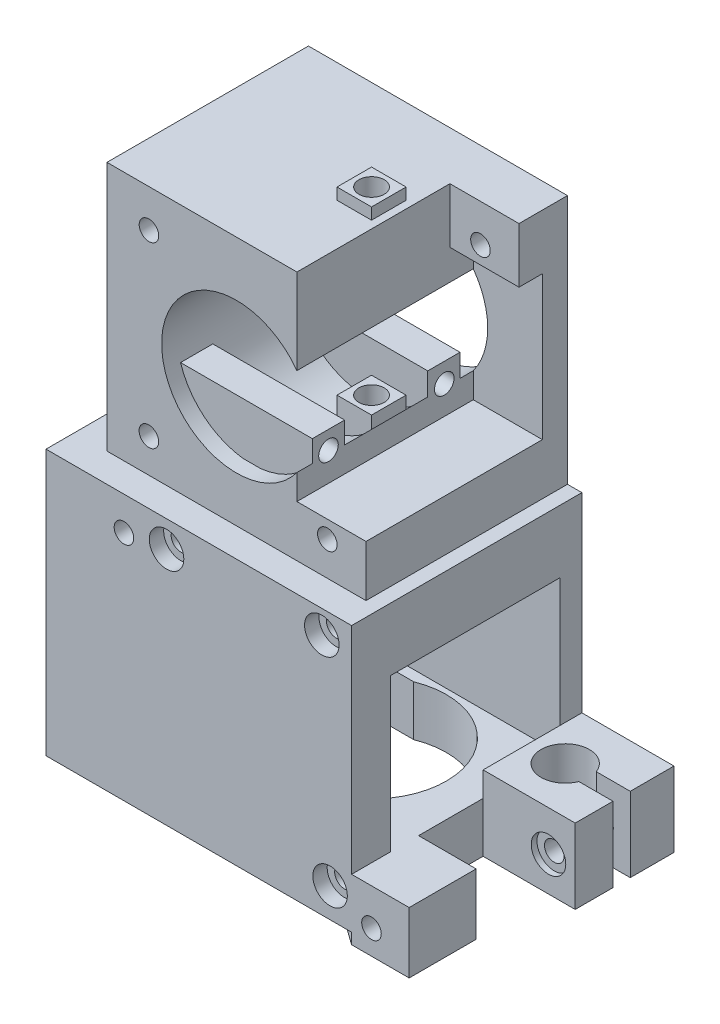
from build123d import *
from OCP.BRepAlgoAPI import BRepAlgoAPI_Cut
from OCP.TopTools import TopTools_ListOfShape

# Parameters (mm, degrees)
SKETCH1_W                     = 45
SKETCH1_H                     = 45
BOSS_EXTRUDE1_DEPTH           = 35
SKETCH2_R                     = 13
CUT_EXTRUDE3_DEPTH            = 35
SKETCH4_R                     = 1.7
CUT_EXTRUDE8_DEPTH            = 35
SKETCH7_R                     = 1.7
CUT_EXTRUDE9_DEPTH            = 35
SKETCH6_R                     = 1.7
CUT_EXTRUDE10_DEPTH           = 35
SKETCH5_R                     = 1.7
CUT_EXTRUDE11_DEPTH           = 35
CUT_EXTRUDE12_DEPTH           = 12
BOSS_EXTRUDE4_START           = -35.102303
SKETCH14_W                    = 6
SKETCH14_H                    = 6
BOSS_EXTRUDE4_DEPTH           = 37.102303
CUT_EXTRUDE17_START           = -7
SKETCH20_R                    = 2.2
CUT_EXTRUDE17_DEPTH           = 70.77141069
SKETCH21_R                    = 1.75
CUT_EXTRUDE18_DEPTH           = 2
BOSS_EXTRUDE5_DEPTH           = 44.571207257
BOSS_EXTRUDE5_DEPTH_BACK      = 1.562633388
SKETCH22_W                    = 53.082637552
SKETCH22_H                    = 40.002520942
SKETCH23_W                    = 29.449729346
SKETCH23_H                    = 26.517519529
CUT_EXTRUDE19_DEPTH           = 95.427299018
SKETCH25_R                    = 5
CUT_EXTRUDE24_DEPTH           = 2.6
SKETCH26_R                    = 8.5
CUT_EXTRUDE25_DEPTH           = 4
SKETCH27_R                    = 6.7
CUT_EXTRUDE28_DEPTH           = 6
SKETCH30_R                    = 13
CUT_EXTRUDE30_DEPTH           = 10.767560088
SKETCH31_W                    = 19.349450051
SKETCH31_H                    = 23.644133728
CUT_EXTRUDE31_DEPTH           = 9.664293754
SKETCH34_R                    = 1.5
CUT_EXTRUDE32_DEPTH           = 9
SKETCH37_W                    = 11.635024897
SKETCH37_H                    = 10.599921236
BOSS_EXTRUDE6_DEPTH           = 10
BOSS_EXTRUDE6_OTHER_WAY_DEPTH = 5
BOSS_EXTRUDE6_OTHER_WAY_TAPER = 29
SKETCH38_R                    = 1.7
CUT_EXTRUDE33_DEPTH           = 10
SKETCH39_R                    = 1.7
CUT_EXTRUDE34_DEPTH           = 88.0662855
SKETCH40_W                    = 17.159872711
SKETCH40_H                    = 13
BOSS_EXTRUDE7_DEPTH           = 16
SKETCH41_R                    = 4.2
CUT_EXTRUDE35_DEPTH           = 15
SKETCH42_W                    = 9.331425876
SKETCH42_H                    = 3
CUT_EXTRUDE36_DEPTH           = 15
CUT_EXTRUDE37_DEPTH           = 5
SKETCH44_R                    = 1.7
CUT_EXTRUDE38_DEPTH           = 23
CUT_EXTRUDE39_DEPTH           = 5
CUT_EXTRUDE40_DEPTH           = 5
CUT_EXTRUDE41_DEPTH           = 5
SKETCH53_R                    = 1.7
CUT_EXTRUDE42_DEPTH           = 90.646740997
SKETCH52_R                    = 1.7
CUT_EXTRUDE43_DEPTH           = 90.646740997
SKETCH51_R                    = 1.7
CUT_EXTRUDE44_DEPTH           = 90.646740997
CUT_EXTRUDE46_DEPTH           = 5
SKETCH57_R                    = 3
CUT_EXTRUDE48_DEPTH           = 2.5
SKETCH58_R                    = 3
CUT_EXTRUDE49_DEPTH           = 2.5
SKETCH59_R                    = 3
CUT_EXTRUDE50_DEPTH           = 2.5
SKETCH60_R                    = 3
CUT_EXTRUDE51_DEPTH           = 1
SKETCH61_W                    = 6.542017971
SKETCH61_H                    = 14.030300317
CUT_EXTRUDE52_DEPTH           = 6.5
SKETCH67_W                    = 5.604230097
SKETCH67_H                    = 8.996545788
BOSS_EXTRUDE8_DEPTH           = 33
SKETCH68_W                    = 5.604230097
SKETCH68_H                    = 9.400155495
BOSS_EXTRUDE9_DEPTH           = 33
SKETCH63_R                    = 1.7
CUT_EXTRUDE55_DEPTH           = 102.92049818
SKETCH62_R                    = 1.7
CUT_EXTRUDE56_DEPTH           = 102.92049818
SKETCH69_R                    = 3
CUT_EXTRUDE57_DEPTH           = 2.5
CUT_EXTRUDE58_DEPTH           = 2.5
SKETCH71_R                    = 3
CUT_EXTRUDE59_DEPTH           = 1


with BuildPart() as part:
    # Sketch1 → Boss-Extrude1 (new body)
    with BuildSketch(Plane.XY):
        Rectangle(SKETCH1_W, SKETCH1_H)
    extrude(amount=BOSS_EXTRUDE1_DEPTH)

    # Sketch2 → Cut-Extrude3 (cut)
    with BuildSketch(Plane.XY.offset(35)):
        Circle(SKETCH2_R)
    extrude(amount=-CUT_EXTRUDE3_DEPTH, mode=Mode.SUBTRACT)

    # Sketch4 → Cut-Extrude8 (cut)
    with BuildSketch(Plane(origin=(0, 0, 0), x_dir=(-1, 0, 0), z_dir=(0, 0, -1))):
        with Locations((-15.808862622, 15.928817575)):
            Circle(SKETCH4_R)
    extrude(amount=-CUT_EXTRUDE8_DEPTH, mode=Mode.SUBTRACT)

    # Sketch7 → Cut-Extrude9 (cut)
    with BuildSketch(Plane(origin=(0, 0, 0), x_dir=(-1, 0, 0), z_dir=(0, 0, -1))):
        with Locations((15.199970606, 15.923392722)):
            Circle(SKETCH7_R)
    extrude(amount=-CUT_EXTRUDE9_DEPTH, mode=Mode.SUBTRACT)

    # Sketch6 → Cut-Extrude10 (cut)
    with BuildSketch(Plane(origin=(0, 0, 0), x_dir=(-1, 0, 0), z_dir=(0, 0, -1))):
        with Locations((15.22029943, -15.065721832)):
            Circle(SKETCH6_R)
    extrude(amount=-CUT_EXTRUDE10_DEPTH, mode=Mode.SUBTRACT)

    # Sketch5 → Cut-Extrude11 (cut)
    with BuildSketch(Plane(origin=(0, 0, 0), x_dir=(-1, 0, 0), z_dir=(0, 0, -1))):
        with Locations((-15.781319068, -15.06525873)):
            Circle(SKETCH5_R)
    extrude(amount=-CUT_EXTRUDE11_DEPTH, mode=Mode.SUBTRACT)

    # Sketch8 → Cut-Extrude12 (cut)
    with BuildSketch(Plane(origin=(22.5, 0, 0), x_dir=(0, 0, -1), z_dir=(1, 0, 0))):
        Polygon((-4.363915061, -12.036124724), (-35, -12.036124724), (-35, 22.5), (-8.423058519, 22.5), (-8.423058519, 12.925541512), (-4.363915061, 12.925541512), align=None)
    extrude(amount=-CUT_EXTRUDE12_DEPTH, mode=Mode.SUBTRACT)

    # Sketch14 → Boss-Extrude4 (add)
    with BuildSketch(Plane(origin=(0, 22.5, 0), x_dir=(1, 0, 0), z_dir=(0, 1, 0)).offset(BOSS_EXTRUDE4_START)):
        with Locations((6.190916669, -17.729312446)):
            Rectangle(SKETCH14_W, SKETCH14_H)
    extrude(amount=BOSS_EXTRUDE4_DEPTH)

    # Sketch20 → Cut-Extrude17 (cut)
    with BuildSketch(Plane(origin=(0, 24.5, 0), x_dir=(1, 0, 0), z_dir=(0, 1, 0)).offset(CUT_EXTRUDE17_START)):
        with Locations(Location((6.190916669, -17.729312446, 0), (0, 0, 90))):
            Circle(SKETCH20_R)
    cut_extrude17 = extrude(amount=CUT_EXTRUDE17_DEPTH, mode=Mode.SUBTRACT)

    # Sketch21 → Cut-Extrude18 (cut)
    with BuildSketch(Plane(origin=(0, 17.5, 0), x_dir=(1, 0, 0), z_dir=(0, 1, 0))):
        with Locations(Location((6.190916669, -17.729312446, 0), (0, 0, 270))):
            Circle(SKETCH21_R)
    extrude(amount=-CUT_EXTRUDE18_DEPTH, mode=Mode.SUBTRACT)

    # Mirror6: Cut-Extrude17 across plane
    add(cut_extrude17.mirror(Plane.ZX.offset(16.5)), mode=Mode.SUBTRACT)

    # Sketch22 → Boss-Extrude5 (add, two sides: drawn at the far end of the back side and taken through both)
    with BuildSketch(Plane.XZ.offset(22.5).offset(-BOSS_EXTRUDE5_DEPTH_BACK)):
        with Locations((-1.541318776, 20.001258793)):
            Rectangle(SKETCH22_W, SKETCH22_H)
    extrude(amount=BOSS_EXTRUDE5_DEPTH + BOSS_EXTRUDE5_DEPTH_BACK)

    # Sketch23 → Cut-Extrude19 (cut, through all)
    with BuildSketch(Plane.ZY.offset(28.082637552)):
        with Locations((18.529138975, -45.100264067)):
            Rectangle(SKETCH23_W, SKETCH23_H)
    extrude(amount=-CUT_EXTRUDE19_DEPTH, mode=Mode.SUBTRACT)

    # Sketch25 → Cut-Extrude24 (cut)
    with BuildSketch(Plane(origin=(0, -20.937366612, 0), x_dir=(1, 0, 0), z_dir=(0, 1, 0))):
        with Locations(Location((6.190916669, -17.729312446, 0), (0, 0, 270))):
            Circle(SKETCH25_R)
    extrude(amount=-CUT_EXTRUDE24_DEPTH, mode=Mode.SUBTRACT)

    # Sketch26 → Cut-Extrude25 (cut)
    with BuildSketch(Plane(origin=(0, -23.537366612, 0), x_dir=(1, 0, 0), z_dir=(0, 1, 0))):
        with Locations(Location((6.190916669, -17.729312446, 0), (0, 0, 270))):
            Circle(SKETCH26_R)
    extrude(amount=-CUT_EXTRUDE25_DEPTH, mode=Mode.SUBTRACT)

    # Sketch27 → Cut-Extrude28 (cut)
    with BuildSketch(Plane(origin=(0, -27.537366612, 0), x_dir=(1, 0, 0), z_dir=(0, 1, 0))):
        with Locations(Location((6.190916669, -17.729312446, 0), (0, 0, 270))):
            Circle(SKETCH27_R)
    extrude(amount=-CUT_EXTRUDE28_DEPTH, mode=Mode.SUBTRACT)

    # Sketch30 → Cut-Extrude30 (cut)
    with BuildSketch(Plane(origin=(0, -58.359023831, 0), x_dir=(1, 0, 0), z_dir=(0, 1, 0))):
        with Locations(Location((6.207851035, -17.729312446, 0), (0, 0, 270))):
            Circle(SKETCH30_R)
    extrude(amount=-CUT_EXTRUDE30_DEPTH, mode=Mode.SUBTRACT)

    # Sketch31 → Cut-Extrude31 (cut)
    with BuildSketch(Plane.XZ.offset(67.071207257)):
        with Locations((-7.592166715, 17.462222744)):
            Rectangle(SKETCH31_W, SKETCH31_H)
    extrude(amount=-CUT_EXTRUDE31_DEPTH, mode=Mode.SUBTRACT)

    # Sketch34 → Cut-Extrude32 (cut)
    with BuildSketch(Plane.ZY.offset(28.082637552)):
        with Locations((35.530918006, -28.494957131)):
            Circle(SKETCH34_R)
        with Locations((3.530918006, -28.494957131)):
            Circle(SKETCH34_R)
        with Locations((35.530918006, -60.494957131)):
            Circle(SKETCH34_R)
        with Locations((3.530918006, -60.494957131)):
            Circle(SKETCH34_R)
    extrude(amount=-CUT_EXTRUDE32_DEPTH, mode=Mode.SUBTRACT)

    # Sketch37 → Boss-Extrude6 (add)
    with BuildSketch(Plane(origin=(25, 0, 0), x_dir=(0, 0, -1), z_dir=(1, 0, 0))):
        with Locations((-34.185004037, -63.658986353)):
            Rectangle(SKETCH37_W, SKETCH37_H)
    extrude(amount=BOSS_EXTRUDE6_DEPTH)

    # Sketch37 → Boss-Extrude6 other way (add)
    with BuildSketch(Plane(origin=(25, 0, 0), x_dir=(0, 0, -1), z_dir=(1, 0, 0))):
        with Locations((-34.185004037, -63.658986353)):
            Rectangle(SKETCH37_W, SKETCH37_H)
    extrude(amount=-BOSS_EXTRUDE6_OTHER_WAY_DEPTH, taper=BOSS_EXTRUDE6_OTHER_WAY_TAPER)

    # Sketch38 → Cut-Extrude33 (cut)
    with BuildSketch(Plane.XY.offset(40.002519264)):
        with Locations((28.454234577, -64.748396148)):
            Circle(SKETCH38_R)
    extrude(amount=-CUT_EXTRUDE33_DEPTH, mode=Mode.SUBTRACT)

    # Sketch39 → Cut-Extrude34 (cut, through all)
    with BuildSketch(Plane.XY.offset(40.002519264)):
        with Locations((-14.545765423, -26.748396148)):
            Circle(SKETCH39_R)
    extrude(amount=-CUT_EXTRUDE34_DEPTH, mode=Mode.SUBTRACT)

    # Sketch40 → Boss-Extrude7 (add)
    with BuildSketch(Plane(origin=(25, 0, 0), x_dir=(0, 0, -1), z_dir=(1, 0, 0))):
        with Locations((-8.579933523, -60.571207257)):
            Rectangle(SKETCH40_W, SKETCH40_H)
    extrude(amount=BOSS_EXTRUDE7_DEPTH)

    # Sketch41 → Cut-Extrude35 (cut)
    with BuildSketch(Plane(origin=(0, -54.071207257, 1.269334023), x_dir=(1, 0, 0), z_dir=(0, 1, 0))):
        with Locations(Location((31.163890056, -7.793414205, 0), (0, 0, 270))):
            Circle(SKETCH41_R)
    extrude(amount=-CUT_EXTRUDE35_DEPTH, mode=Mode.SUBTRACT)

    # Sketch42 → Cut-Extrude36 (cut)
    with BuildSketch(Plane(origin=(0, -54.071207257, 0), x_dir=(1, 0, 0), z_dir=(0, 1, 0))):
        with Locations((38.19390682, -9.095710432)):
            Rectangle(SKETCH42_W, SKETCH42_H)
    extrude(amount=-CUT_EXTRUDE36_DEPTH, mode=Mode.SUBTRACT)


with BuildPart() as cut_extrude37_tool:
    # Sketch43 → Cut-Extrude37 (new body)
    with BuildSketch(Plane(origin=(0, 0, 0), x_dir=(-1, 0, 0), z_dir=(0, 0, -1))):
        Polygon((-34.628927379, -64.403909926), (-32.738460245, -61.095415705), (-34.658466721, -57.80397603), (-38.468940333, -57.821030577), (-40.359407467, -61.129524799), (-38.439400991, -64.420964473), align=None)
    extrude(amount=-CUT_EXTRUDE37_DEPTH)


with BuildPart() as part_1:
    add(part.part)

    # Cut-Extrude37: cut by cut_extrude37_tool, with a tolerance
    cut_extrude37_stock = TopTools_ListOfShape()
    cut_extrude37_stock.Append(part_1.part.wrapped)
    cut_extrude37_tools = TopTools_ListOfShape()
    cut_extrude37_tools.Append(cut_extrude37_tool.part.wrapped)
    cut_extrude37_cut = BRepAlgoAPI_Cut()
    cut_extrude37_cut.SetArguments(cut_extrude37_stock)
    cut_extrude37_cut.SetTools(cut_extrude37_tools)
    cut_extrude37_cut.SetFuzzyValue(0.00001)
    cut_extrude37_cut.Build()
    add(Compound.cast(cut_extrude37_cut.Shape()).solids(), mode=Mode.REPLACE)

    # Sketch44 → Cut-Extrude38 (cut)
    with BuildSketch(Plane.XY.offset(17.159869878)):
        with Locations(Location((36.360549159, -61.087091915, 0), (0, 0, 137.89225519))):
            Circle(SKETCH44_R)
    extrude(amount=-CUT_EXTRUDE38_DEPTH, mode=Mode.SUBTRACT)


with BuildPart() as cut_extrude39_tool:
    # Sketch48 → Cut-Extrude39 (new body)
    with BuildSketch(Plane(origin=(0, 0, 0), x_dir=(-1, 0, 0), z_dir=(0, 0, -1))):
        Polygon((9.066729233, -28.811078933), (10.957196368, -25.502584711), (9.037189891, -22.211145037), (5.22671628, -22.228199584), (3.336249145, -25.536693806), (5.256255622, -28.82813348), align=None)
    extrude(amount=-CUT_EXTRUDE39_DEPTH)


with BuildPart() as part_2:
    add(part_1.part)

    # Cut-Extrude39: cut by cut_extrude39_tool, with a tolerance
    cut_extrude39_stock = TopTools_ListOfShape()
    cut_extrude39_stock.Append(part_2.part.wrapped)
    cut_extrude39_tools = TopTools_ListOfShape()
    cut_extrude39_tools.Append(cut_extrude39_tool.part.wrapped)
    cut_extrude39_cut = BRepAlgoAPI_Cut()
    cut_extrude39_cut.SetArguments(cut_extrude39_stock)
    cut_extrude39_cut.SetTools(cut_extrude39_tools)
    cut_extrude39_cut.SetFuzzyValue(0.00001)
    cut_extrude39_cut.Build()
    add(Compound.cast(cut_extrude39_cut.Shape()).solids(), mode=Mode.REPLACE)


with BuildPart() as cut_extrude40_tool:
    # Sketch49 → Cut-Extrude40 (new body)
    with BuildSketch(Plane(origin=(0, 0, 0), x_dir=(-1, 0, 0), z_dir=(0, 0, -1))):
        Polygon((-19.339505263, -65.26594849), (-17.449038128, -61.957454268), (-19.369044605, -58.666014594), (-23.179518216, -58.683069141), (-25.06998535, -61.991563363), (-23.149978874, -65.283003037), align=None)
    extrude(amount=-CUT_EXTRUDE40_DEPTH)


with BuildPart() as part_3:
    add(part_2.part)

    # Cut-Extrude40: cut by cut_extrude40_tool, with a tolerance
    cut_extrude40_stock = TopTools_ListOfShape()
    cut_extrude40_stock.Append(part_3.part.wrapped)
    cut_extrude40_tools = TopTools_ListOfShape()
    cut_extrude40_tools.Append(cut_extrude40_tool.part.wrapped)
    cut_extrude40_cut = BRepAlgoAPI_Cut()
    cut_extrude40_cut.SetArguments(cut_extrude40_stock)
    cut_extrude40_cut.SetTools(cut_extrude40_tools)
    cut_extrude40_cut.SetFuzzyValue(0.00001)
    cut_extrude40_cut.Build()
    add(Compound.cast(cut_extrude40_cut.Shape()).solids(), mode=Mode.REPLACE)


with BuildPart() as cut_extrude41_tool:
    # Sketch50 → Cut-Extrude41 (new body)
    with BuildSketch(Plane(origin=(0, 0, 0), x_dir=(-1, 0, 0), z_dir=(0, 0, -1))):
        Polygon((-17.911640095, -28.243498116), (-16.02117296, -24.935003895), (-17.941179437, -21.64356422), (-21.751653048, -21.660618767), (-23.642120183, -24.969112989), (-21.722113706, -28.260552663), align=None)
    extrude(amount=-CUT_EXTRUDE41_DEPTH)


with BuildPart() as part_4:
    add(part_3.part)

    # Cut-Extrude41: cut by cut_extrude41_tool, with a tolerance
    cut_extrude41_stock = TopTools_ListOfShape()
    cut_extrude41_stock.Append(part_4.part.wrapped)
    cut_extrude41_tools = TopTools_ListOfShape()
    cut_extrude41_tools.Append(cut_extrude41_tool.part.wrapped)
    cut_extrude41_cut = BRepAlgoAPI_Cut()
    cut_extrude41_cut.SetArguments(cut_extrude41_stock)
    cut_extrude41_cut.SetTools(cut_extrude41_tools)
    cut_extrude41_cut.SetFuzzyValue(0.00001)
    cut_extrude41_cut.Build()
    add(Compound.cast(cut_extrude41_cut.Shape()).solids(), mode=Mode.REPLACE)

    # Sketch53 → Cut-Extrude42 (cut, through all)
    with BuildSketch(Plane.XY.offset(40.002519264)):
        with Locations((21.259511739, -61.974508816)):
            Circle(SKETCH53_R)
    extrude(amount=-CUT_EXTRUDE42_DEPTH, mode=Mode.SUBTRACT)

    # Sketch52 → Cut-Extrude43 (cut, through all)
    with BuildSketch(Plane.XY.offset(40.002519264)):
        with Locations((19.831646572, -24.952058442)):
            Circle(SKETCH52_R)
    extrude(amount=-CUT_EXTRUDE43_DEPTH, mode=Mode.SUBTRACT)

    # Sketch51 → Cut-Extrude44 (cut, through all)
    with BuildSketch(Plane.XY.offset(40.002519264)):
        with Locations((-7.146722757, -25.519639258)):
            Circle(SKETCH51_R)
    extrude(amount=-CUT_EXTRUDE44_DEPTH, mode=Mode.SUBTRACT)


with BuildPart() as cut_extrude46_tool:
    # Sketch55 → Cut-Extrude46 (new body)
    with BuildSketch(Plane(origin=(0, 0, 0), x_dir=(-1, 0, 0), z_dir=(0, 0, -1))):
        Polygon((16.584868726, -29.967411171), (18.35306586, -26.591988399), (16.313962558, -23.372973375), (12.506662121, -23.529381124), (10.738464986, -26.904803896), (12.777568289, -30.12381892), align=None)
    extrude(amount=-CUT_EXTRUDE46_DEPTH)


with BuildPart() as part_5:
    add(part_4.part)

    # Cut-Extrude46: cut by cut_extrude46_tool, with a tolerance
    cut_extrude46_stock = TopTools_ListOfShape()
    cut_extrude46_stock.Append(part_5.part.wrapped)
    cut_extrude46_tools = TopTools_ListOfShape()
    cut_extrude46_tools.Append(cut_extrude46_tool.part.wrapped)
    cut_extrude46_cut = BRepAlgoAPI_Cut()
    cut_extrude46_cut.SetArguments(cut_extrude46_stock)
    cut_extrude46_cut.SetTools(cut_extrude46_tools)
    cut_extrude46_cut.SetFuzzyValue(0.00001)
    cut_extrude46_cut.Build()
    add(Compound.cast(cut_extrude46_cut.Shape()).solids(), mode=Mode.REPLACE)

    # Sketch57 → Cut-Extrude48 (cut)
    with BuildSketch(Plane.XY.offset(40.002519264)):
        with Locations((-7.146722757, -25.519639258)):
            Circle(SKETCH57_R)
    extrude(amount=-CUT_EXTRUDE48_DEPTH, mode=Mode.SUBTRACT)

    # Sketch58 → Cut-Extrude49 (cut)
    with BuildSketch(Plane.XY.offset(40.002519264)):
        with Locations((19.831646572, -24.952058442)):
            Circle(SKETCH58_R)
    extrude(amount=-CUT_EXTRUDE49_DEPTH, mode=Mode.SUBTRACT)

    # Sketch59 → Cut-Extrude50 (cut)
    with BuildSketch(Plane.XY.offset(40.002519264)):
        with Locations((21.259511739, -61.974508816)):
            Circle(SKETCH59_R)
    extrude(amount=-CUT_EXTRUDE50_DEPTH, mode=Mode.SUBTRACT)

    # Sketch60 → Cut-Extrude51 (cut)
    with BuildSketch(Plane(origin=(0, 0, 0), x_dir=(-1, 0, 0), z_dir=(0, 0, -1))):
        with Locations((-15.808862622, 15.928817575)):
            Circle(SKETCH60_R)
        with Locations((15.199970606, 15.923392722)):
            Circle(SKETCH60_R)
        with Locations((-15.781319068, -15.06525873)):
            Circle(SKETCH60_R)
        with Locations((15.22029943, -15.065721832)):
            Circle(SKETCH60_R)
    extrude(amount=-CUT_EXTRUDE51_DEPTH, mode=Mode.SUBTRACT)

    # Sketch61 → Cut-Extrude52 (cut)
    with BuildSketch(Plane(origin=(9.190916669, 0, 0), x_dir=(0, 0, -1), z_dir=(1, 0, 0))):
        with Locations((-17.812553374, 0.202623489)):
            Rectangle(SKETCH61_W, SKETCH61_H)
    extrude(amount=-CUT_EXTRUDE52_DEPTH, mode=Mode.SUBTRACT)

    # Sketch67 → Boss-Extrude8 (add)
    with BuildSketch(Plane(origin=(-22.5, -2.468350024, 0), x_dir=(0, 0, 1), z_dir=(-1, 0, 0))):
        with Locations((29.51622543, -5.940778019)):
            Rectangle(SKETCH67_W, SKETCH67_H)
    extrude(amount=-BOSS_EXTRUDE8_DEPTH)

    # Sketch68 → Boss-Extrude9 (add)
    with BuildSketch(Plane(origin=(-22.5, -2.468350024, 0), x_dir=(0, 0, 1), z_dir=(-1, 0, 0))):
        with Locations((9.47264346, -5.966332429)):
            Rectangle(SKETCH68_W, SKETCH68_H)
    extrude(amount=-BOSS_EXTRUDE9_DEPTH)

    # Sketch63 → Cut-Extrude55 (cut, through all)
    with BuildSketch(Plane.ZY.offset(22.5)):
        with Locations(Location((29.516225429, -7.068802512, 0), (0, 0, 270))):
            Circle(SKETCH63_R)
    extrude(amount=-CUT_EXTRUDE55_DEPTH, mode=Mode.SUBTRACT)

    # Sketch62 → Cut-Extrude56 (cut, through all)
    with BuildSketch(Plane.ZY.offset(22.5)):
        with Locations(Location((9.403782955, -7.127149089, 0), (0, 0, 270))):
            Circle(SKETCH62_R)
    extrude(amount=-CUT_EXTRUDE56_DEPTH, mode=Mode.SUBTRACT)

    # Sketch69 → Cut-Extrude57 (cut)
    with BuildSketch(Plane.ZY.offset(22.5)):
        with Locations(Location((9.403782955, -7.127149089, 0), (0, 0, 270))):
            Circle(SKETCH69_R)
        with Locations(Location((29.516225429, -7.068802512, 0), (0, 0, 270))):
            Circle(SKETCH69_R)
    extrude(amount=-CUT_EXTRUDE57_DEPTH, mode=Mode.SUBTRACT)

    # Sketch70 → Cut-Extrude58 (cut)
    with BuildSketch(Plane(origin=(0, 0, 28.367491588), x_dir=(-1, 0, 0), z_dir=(0, 0, -1))):
        Polygon((-25.203073509, -66.735844691), (-25.107473116, -62.926532343), (-28.358634183, -60.9390838), (-31.705395644, -62.760947604), (-31.800996038, -66.570259952), (-28.54983497, -68.557708496), align=None)
    extrude(amount=-CUT_EXTRUDE58_DEPTH, mode=Mode.SUBTRACT)

    # Sketch71 → Cut-Extrude59 (cut)
    with BuildSketch(Plane.XY.offset(17.159869878)):
        with Locations((36.360549159, -61.087091915)):
            Circle(SKETCH71_R)
    extrude(amount=-CUT_EXTRUDE59_DEPTH, mode=Mode.SUBTRACT)


solid = part_5.part
